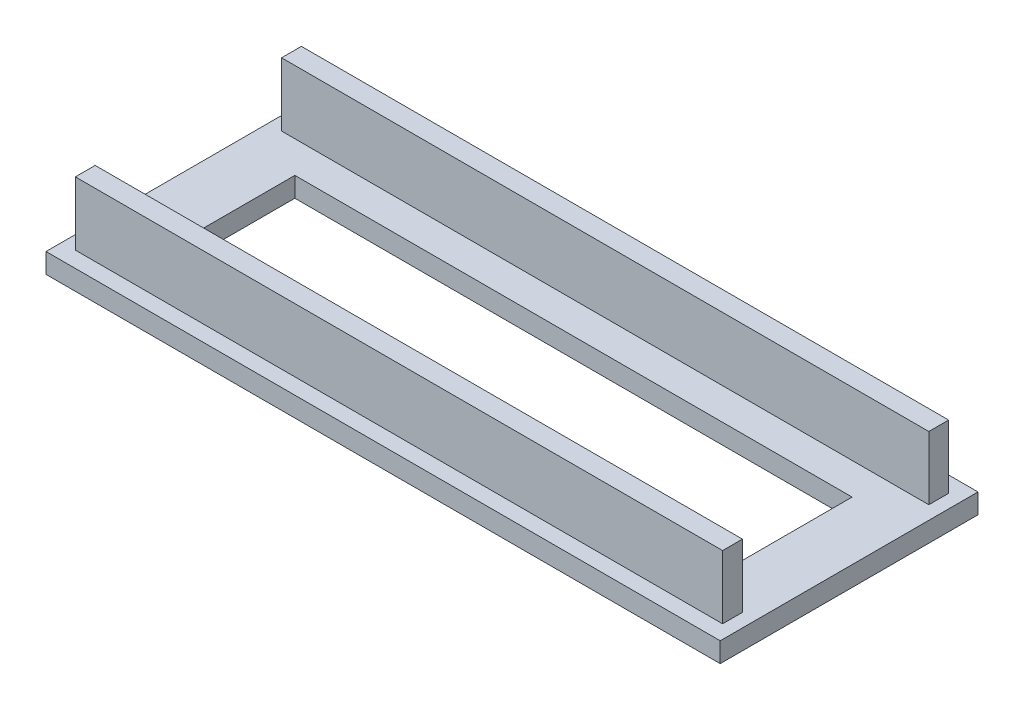
from build123d import *

# Parameters (mm, degrees)
F_01_RAIL_BASE_PROFILE_W   = 340
F_01_RAIL_BASE_PROFILE_H   = 130
F_01_RAIL_BASE_PROFILE_R   = 4.5
F_01_RAIL_BASE_PROFILE_W_2 = 281
F_01_RAIL_BASE_PROFILE_H_2 = 62
F_01_RAIL_BASE_DEPTH       = 10
F_02_GUIDE_RAIL_PROFILES_W = 326.4
F_02_GUIDE_RAIL_PROFILES_H = 10
F_02_GUIDE_RAILS_DEPTH     = 42


with BuildPart() as part:
    # 01_Rail_Base_Profile → 01_Rail_Base (new body)
    with BuildSketch(Plane(origin=(0, 0, 0), x_dir=(1, 0, 0), z_dir=(0, 1, 0))):
        Rectangle(F_01_RAIL_BASE_PROFILE_W, F_01_RAIL_BASE_PROFILE_H)
        with Locations((-145, -52)):
            Circle(F_01_RAIL_BASE_PROFILE_R, mode=Mode.SUBTRACT)
        with Locations((-145, 52)):
            Circle(F_01_RAIL_BASE_PROFILE_R, mode=Mode.SUBTRACT)
        with Locations((145, -52)):
            Circle(F_01_RAIL_BASE_PROFILE_R, mode=Mode.SUBTRACT)
        with Locations((145, 52)):
            Circle(F_01_RAIL_BASE_PROFILE_R, mode=Mode.SUBTRACT)
        Rectangle(F_01_RAIL_BASE_PROFILE_W_2, F_01_RAIL_BASE_PROFILE_H_2, mode=Mode.SUBTRACT)
    extrude(amount=F_01_RAIL_BASE_DEPTH)

    # 02_Guide_Rail_Profiles → 02_Guide_Rails (add)
    with BuildSketch(Plane(origin=(0, 0, 0), x_dir=(1, 0, 0), z_dir=(0, 1, 0))):
        with Locations((0, 52)):
            Rectangle(F_02_GUIDE_RAIL_PROFILES_W, F_02_GUIDE_RAIL_PROFILES_H)
        with Locations((0, -52)):
            Rectangle(F_02_GUIDE_RAIL_PROFILES_W, F_02_GUIDE_RAIL_PROFILES_H)
    extrude(amount=F_02_GUIDE_RAILS_DEPTH)


solid = part.part
